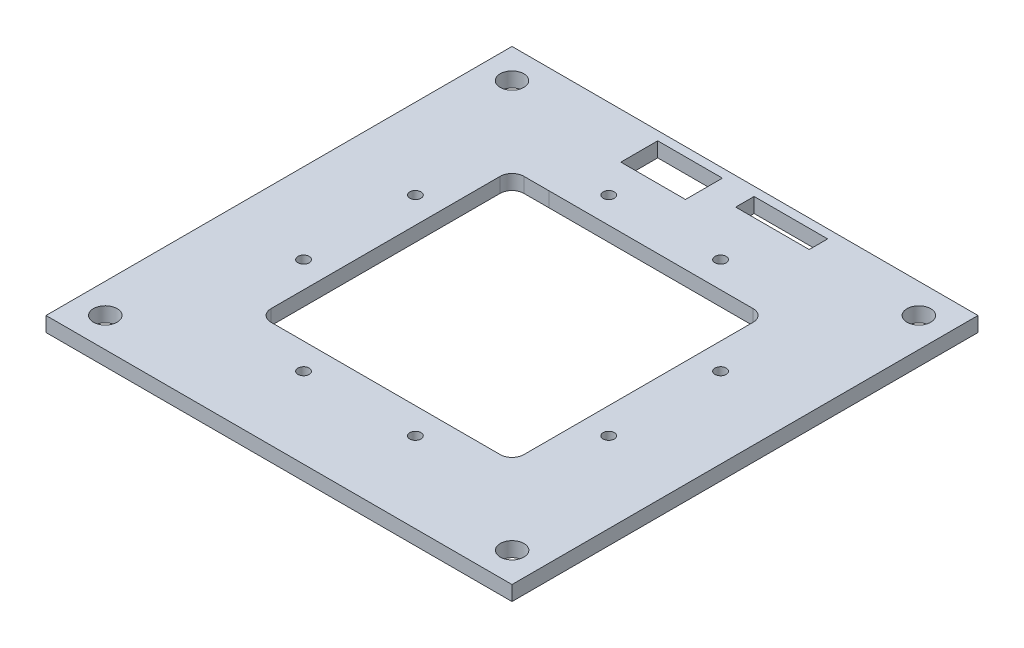
from build123d import *

# Parameters (mm, degrees)
SKETCH1_W           = 200.025
SKETCH1_H           = 200.025
SKETCH1_R           = 5.08
SKETCH1_W_2         = 27.758924323
SKETCH1_H_2         = 15.850492031
SKETCH1_W_3         = 31.563171913
SKETCH1_H_3         = 7.913427648
BOSS_EXTRUDE1_DEPTH = 6.35
FILLET1_R           = 5.08
SKETCH3_R           = 2.4
CUT_EXTRUDE1_DEPTH  = 142.598203764


with BuildPart() as part:
    # Sketch1 → Boss-Extrude1 (new body)
    with BuildSketch(Plane(origin=(0, 0, 0), x_dir=(1, 0, 0), z_dir=(0, 1, 0))):
        with Locations((0, -0.023636735)):
            Rectangle(SKETCH1_W, SKETCH1_H)
        with Locations((-87.3125, 87.288863265)):
            Circle(SKETCH1_R, mode=Mode.SUBTRACT)
        with Locations((87.3125, 87.288863265)):
            Circle(SKETCH1_R, mode=Mode.SUBTRACT)
        with Locations((-87.3125, -87.288863265)):
            Circle(SKETCH1_R, mode=Mode.SUBTRACT)
        with Locations((87.3125, -87.288863265)):
            Circle(SKETCH1_R, mode=Mode.SUBTRACT)
        with Locations((-19.766444167, 88.253617249)):
            Rectangle(SKETCH1_W_2, SKETCH1_H_2, mode=Mode.SUBTRACT)
        with Locations((23.505506165, 92.222149441)):
            Rectangle(SKETCH1_W_3, SKETCH1_H_3, mode=Mode.SUBTRACT)
        Polygon((54.27, -38.5), (54.27, 38.5), (54.293636735, 54.27), (38.5, 54.27), (-38.5, 54.27), (-54.27, 54.246363265), (-54.27, 38.5), (-54.27, -38.5), (-54.27, -54.293636735), (-42.77, -54.27), (-38.5, -54.27), (38.5, -54.27), (42.77, -54.27), (54.246363265, -54.27), (54.27, -42.77), align=None, mode=Mode.SUBTRACT)
    extrude(amount=BOSS_EXTRUDE1_DEPTH)

    # Fillet1
    fillet1_edges = [part.edges().sort_by_distance(p)[0] for p in [
        (54.246363265, 3.175, 54.27),
        (-54.27, 3.175, 54.293636735),
        (54.293636735, 3.175, -54.27),
        (-54.27, 3.175, -54.246363265),
    ]]
    fillet(fillet1_edges, radius=FILLET1_R)

    # Sketch3 → Cut-Extrude1 (cut, through all)
    with BuildSketch(Plane.XZ):
        with Locations((-24, 65.5)):
            Circle(SKETCH3_R)
        with Locations((24, 65.5)):
            Circle(SKETCH3_R)
        with Locations((65.5, -24)):
            Circle(SKETCH3_R)
        with Locations((65.5, 24)):
            Circle(SKETCH3_R)
        with Locations((-24, -65.5)):
            Circle(SKETCH3_R)
        with Locations((24, -65.5)):
            Circle(SKETCH3_R)
        with Locations((-65.5, 24)):
            Circle(SKETCH3_R)
        with Locations((-65.5, -24)):
            Circle(SKETCH3_R)
    extrude(amount=-CUT_EXTRUDE1_DEPTH, mode=Mode.SUBTRACT)


solid = part.part
